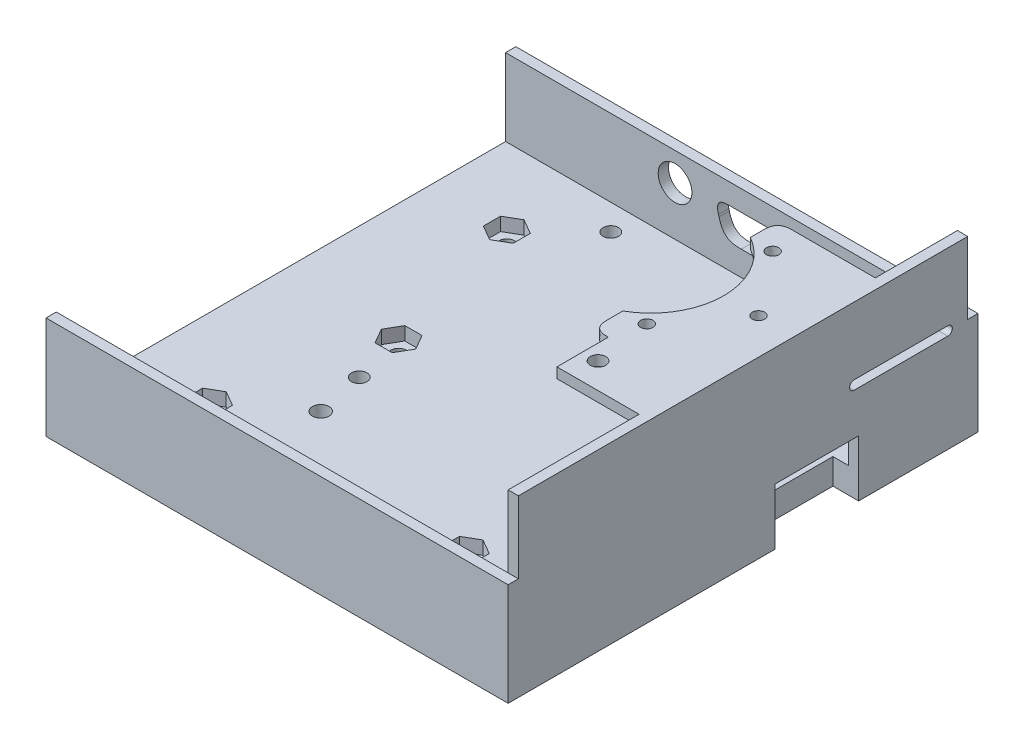
from build123d import *

# Parameters (mm, degrees)
SKETCH1_W                = 91
SKETCH1_H                = 91.5
SKETCH1_W_2              = 87
SKETCH1_H_2              = 87.5
SKETCH1_W_3              = 2
BOSS_EXTRUDE2_DEPTH      = 2
BOSS_EXTRUDE5_DEPTH      = 20
SKETCH3_W                = 2
SKETCH3_H                = 87.5
BOSS_EXTRUDE6_DEPTH      = 29
CUT_EXTRUDE1_DEPTH       = 107.787171514
CUT_EXTRUDE1_DEPTH_BACK  = 107.787171514
SKETCH4_W                = 1
SKETCH4_H                = 9.5
SKETCH4_H_2              = 6.5
SKETCH4_H_3              = 4
SKETCH8_W                = 36
SKETCH8_H                = 2
BOSS_EXTRUDE7_DEPTH      = 19
CUT_EXTRUDE3_REACH       = 73.584
SKETCH9_R                = 14.25
M2_CLEARANCE_HOLE1_D     = 2.4
M2_CLEARANCE_HOLE1_DEPTH = 2
SKETCH15_W               = 90
SKETCH15_H               = 3
CUT_EXTRUDE10_DEPTH      = 2
SKETCH5_W                = 90
SKETCH5_H                = 3
CUT_EXTRUDE11_DEPTH      = 2
CUT_EXTRUDE4_REACH       = 108.787
SKETCH13_R               = 3.28
FILLET2_SIZE             = 3
FILLET3_START            = -45.75
FILLET3_OUTLINE_W        = 45
FILLET3_OUTLINE_H        = 10
FILLET3_DEPTH            = 2
CUT_EXTRUDE7_REACH       = 107.613
SKETCH16_W               = 16.25
SKETCH16_H               = 8
CUT_EXTRUDE8_DEPTH       = 5
BOSS_EXTRUDE9_DEPTH      = 3
SKETCH17_R               = 1.5
CUT_EXTRUDE12_DEPTH      = 71.741165696
SKETCH19_R               = 1.625
CUT_EXTRUDE13_DEPTH      = 71.741165696
CUT_EXTRUDE21_DEPTH      = 2.6
SKETCH23_R               = 1.5
CUT_EXTRUDE22_DEPTH      = 8
CUT_EXTRUDE23_DEPTH      = 2.6
SKETCH24_W               = 20
SKETCH24_H               = 7
BOSS_EXTRUDE10_DEPTH     = 5
CUT_EXTRUDE26_REACH      = 72.741
SKETCH20_8_R             = 1.5
SKETCH26_W               = 10
SKETCH26_H               = 2
BOSS_EXTRUDE11_DEPTH     = 16
CUT_EXTRUDE27_REACH      = 77.394
SKETCH28_R               = 1.5
SKETCH29_R               = 1.55
SKETCH29_R_2             = 1.5
CUT_EXTRUDE28_DEPTH      = 2.6
CUT_EXTRUDE29_REACH      = 72.741
SKETCH29_3_R             = 1.5
SKETCH29_3_R_2           = 1.55


with BuildPart() as part:
    # Sketch1 → Boss-Extrude2 (new body)
    # profile 1 of 5: a face of its own
    with BuildSketch(Plane(origin=(0, 0, 0), x_dir=(1, 0, 0), z_dir=(0, 1, 0))):
        Rectangle(SKETCH1_W, SKETCH1_H)
        Rectangle(SKETCH1_W_2, SKETCH1_H_2, mode=Mode.SUBTRACT)
    # profile 2 of 5: a face of its own
    with BuildSketch(Plane(origin=(0, 0, 0), x_dir=(1, 0, 0), z_dir=(0, 1, 0))):
        Rectangle(SKETCH1_W_2, SKETCH1_H_2)
    # profile 3 of 5: a face of its own
    with BuildSketch(Plane(origin=(0, 0, 0), x_dir=(1, 0, 0), z_dir=(0, 1, 0))):
        with Locations((-44.5, 0)):
            Rectangle(SKETCH1_W_3, SKETCH1_H_2)
    # profile 4 of 5: a face of its own
    with BuildSketch(Plane(origin=(0, 0, 0), x_dir=(1, 0, 0), z_dir=(0, 1, 0))):
        with Locations((44.5, 0)):
            Rectangle(SKETCH1_W_3, SKETCH1_H_2)
    # profile 5 of 5: a face of its own
    with BuildSketch(Plane(origin=(0, 0, 0), x_dir=(1, 0, 0), z_dir=(0, 1, 0))):
        Polygon((-45.5, 45.75), (-45.5, 43.75), (-43.5, 43.75), (43.5, 43.75), (45.5, 43.75), (45.5, 45.75), align=None)
    extrude(amount=BOSS_EXTRUDE2_DEPTH)

    # Sketch1<4> → Boss-Extrude5 (add)
    with BuildSketch(Plane(origin=(0, 0, 0), x_dir=(1, 0, 0), z_dir=(0, 1, 0))):
        Polygon((-45.5, -43.75), (-45.5, -45.75), (45.5, -45.75), (45.5, -43.75), (43.5, -43.75), (-43.5, -43.75), align=None)
        Polygon((-45.5, 45.75), (-45.5, 43.75), (-43.5, 43.75), (43.5, 43.75), (45.5, 43.75), (45.5, 45.75), align=None)
    extrude(amount=BOSS_EXTRUDE5_DEPTH)

    # Sketch3 → Boss-Extrude6 (add)
    with BuildSketch(Plane(origin=(0, 2, 0), x_dir=(1, 0, 0), z_dir=(0, 1, 0))):
        with Locations((44.5, 0)):
            Rectangle(SKETCH3_W, SKETCH3_H)
    extrude(amount=BOSS_EXTRUDE6_DEPTH)

    # Sketch4 → Cut-Extrude1 (cut, two sides: drawn at the far end of the back side and taken through both)
    with BuildSketch(Plane.XY.offset(45.75).offset(-CUT_EXTRUDE1_DEPTH_BACK)):
        with Locations((-45, 15.25)):
            Rectangle(SKETCH4_W, SKETCH4_H)
        with Locations((-45, 3.25)):
            Rectangle(SKETCH4_W, SKETCH4_H_2)
        with Locations((-45, 8.5)):
            Rectangle(SKETCH4_W, SKETCH4_H_3)
    extrude(amount=CUT_EXTRUDE1_DEPTH + CUT_EXTRUDE1_DEPTH_BACK, mode=Mode.SUBTRACT)

    # Sketch8 → Boss-Extrude7 (add)
    with BuildSketch(Plane.ZY.offset(-43.5)):
        with Locations((-9.75, 30)):
            Rectangle(SKETCH8_W, SKETCH8_H)
    extrude(amount=BOSS_EXTRUDE7_DEPTH)

    # Sketch9 → Cut-Extrude3 (cut, up to next)
    with BuildSketch(Plane(origin=(0, 31, 0), x_dir=(1, 0, 0), z_dir=(0, 1, 0)), mode=Mode.PRIVATE) as cut_extrude3_sk1:
        with Locations((17.5, 10)):
            Circle(SKETCH9_R)
    cut_extrude3_tool1 = extrude(cut_extrude3_sk1.sketch, amount=-CUT_EXTRUDE3_REACH, mode=Mode.PRIVATE) & part.part
    add(cut_extrude3_tool1.solids().sort_by_distance((17.5, 31, -10))[0], mode=Mode.SUBTRACT)

    # M2 Clearance Hole1
    with Locations(Plane(origin=(0, 31, 0), x_dir=(1, 0, 0), z_dir=(0, 1, 0))):
        with Locations((29, -2.25), (38.5, 10), (29, 22.25)):
            Hole(M2_CLEARANCE_HOLE1_D / 2, depth=M2_CLEARANCE_HOLE1_DEPTH)

    # Sketch15 → Cut-Extrude10 (cut)
    with BuildSketch(Plane(origin=(0, 0, -45.75), x_dir=(-1, 0, 0), z_dir=(0, 0, -1))):
        with Locations((-0.5, 18.5)):
            Rectangle(SKETCH15_W, SKETCH15_H)
    extrude(amount=-CUT_EXTRUDE10_DEPTH, mode=Mode.SUBTRACT)

    # Sketch5 → Cut-Extrude11 (cut)
    with BuildSketch(Plane.XY.offset(45.75)):
        with Locations((0.5, 18.5)):
            Rectangle(SKETCH5_W, SKETCH5_H)
    extrude(amount=-CUT_EXTRUDE11_DEPTH, mode=Mode.SUBTRACT)

    # Sketch13 → Cut-Extrude4 (cut, up to next)
    with BuildSketch(Plane(origin=(0, 0, -45.75), x_dir=(-1, 0, 0), z_dir=(0, 0, -1)), mode=Mode.PRIVATE) as cut_extrude4_sk1:
        with Locations((11.5, 11.5)):
            Circle(SKETCH13_R)
    cut_extrude4_tool1 = extrude(cut_extrude4_sk1.sketch, amount=-CUT_EXTRUDE4_REACH, mode=Mode.PRIVATE) & part.part
    # Sketch13 → Cut-Extrude4 (cut, up to next)
    with BuildSketch(Plane(origin=(0, 0, -45.75), x_dir=(-1, 0, 0), z_dir=(0, 0, -1)), mode=Mode.PRIVATE) as cut_extrude4_sk2:
        Polygon((-8, 6.8), (2, 6.8), (3.75, 13), (-9.75, 13), align=None)
    cut_extrude4_tool2 = extrude(cut_extrude4_sk2.sketch, amount=-CUT_EXTRUDE4_REACH, mode=Mode.PRIVATE) & part.part
    # Sketch13 → Cut-Extrude4 (cut, up to next)
    with BuildSketch(Plane(origin=(0, 0, -45.75), x_dir=(-1, 0, 0), z_dir=(0, 0, -1)), mode=Mode.PRIVATE) as cut_extrude4_sk3:
        Polygon((-11.7, 6.75), (-9.95, 13), (-23.45, 13), (-21.7, 6.75), align=None)
    cut_extrude4_tool3 = extrude(cut_extrude4_sk3.sketch, amount=-CUT_EXTRUDE4_REACH, mode=Mode.PRIVATE) & part.part
    # Sketch13 → Cut-Extrude4 (cut, up to next)
    with BuildSketch(Plane(origin=(0, 0, -45.75), x_dir=(-1, 0, 0), z_dir=(0, 0, -1)), mode=Mode.PRIVATE) as cut_extrude4_sk4:
        Polygon((-38.26, 13), (-24.76, 13), (-26.51, 6.75), (-36.51, 6.75), align=None)
    cut_extrude4_tool4 = extrude(cut_extrude4_sk4.sketch, amount=-CUT_EXTRUDE4_REACH, mode=Mode.PRIVATE) & part.part
    add(cut_extrude4_tool1.solids().sort_by_distance((-11.5, 11.5, -45.75))[0], mode=Mode.SUBTRACT)
    add(cut_extrude4_tool2.solids().sort_by_distance((3, 10.053901, -45.75))[0], mode=Mode.SUBTRACT)
    add(cut_extrude4_tool3.solids().sort_by_distance((16.7, 10.030142, -45.75))[0], mode=Mode.SUBTRACT)
    add(cut_extrude4_tool4.solids().sort_by_distance((31.51, 10.030142, -45.75))[0], mode=Mode.SUBTRACT)

    # Fillet2
    # a fillet whose section is not a circle: 3 mm, written as the material it takes off along each edge
    with BuildSketch(Plane(origin=(24.5, 21.5, -27.75), x_dir=(1, 0, 0), z_dir=(0, 1, 0)), Plane(origin=(24.5, 38.5, 8.25), x_dir=(1, 0, 0), z_dir=(0, -1, 0))) as fillet2_piece_1:
        with BuildLine():
            add(Edge.make_bspline([(FILLET2_SIZE, 0), (FILLET2_SIZE * 0.831801948466, 0), (FILLET2_SIZE * 0.663603896932, 0), (FILLET2_SIZE * 0.292893218813, -FILLET2_SIZE * 0.0716919198361), (FILLET2_SIZE * 0.0716919198361, -FILLET2_SIZE * 0.292893218813), (0, -FILLET2_SIZE * 0.663603896932), (0, -FILLET2_SIZE * 0.831801948466), (0, -FILLET2_SIZE)], knots=[0, 0, 0, 0, 0, 0, 0.5, 0.5, 1, 1, 1, 1, 1, 1], degree=5))
            Line((0, -FILLET2_SIZE), (0, 0))
            Line((0, 0), (FILLET2_SIZE, 0))
        make_face()
    extrude(amount=17, mode=Mode.SUBTRACT)

    # Fillet3: read off the stored shape, not the designer's step
    # Fillet3 outline → Fillet3 (add)
    # profile 1 of 5: a face of its own
    with BuildSketch(Plane.XY.offset(FILLET3_START)):
        with Locations((17.5, 10)):
            Rectangle(FILLET3_OUTLINE_W, FILLET3_OUTLINE_H)
        with BuildLine():
            Line((4.594339469, 6.8), (1.405660531, 6.8))
            add(Edge.make_bspline(
                [(1.405660531, 6.8), (0.810289384, 6.8), (0.214918236, 6.8), (-1.10940405, 7.001225111), (-2.048266916, 7.711769157), (-2.601670361, 8.931632138), (-2.76339966, 9.504615939), (-2.925128959, 10.077599741)],
                knots=[0, 0, 0, 0, 0, 0, 0.5, 0.5, 1, 1, 1, 1, 1, 1], degree=5))
            Line((-2.925128959, 10.077599741), (-3.032136168, 10.456710996))
            add(Edge.make_bspline(
                [(-3.032136168, 10.456710996), (-3.146764266, 10.862821971), (-3.261392364, 11.268932946), (-3.301677592, 12.20694283), (-2.864979315, 12.783965182), (-1.951297532, 13), (-1.529319186, 13), (-1.107340839, 13)],
                knots=[0, 0, 0, 0, 0, 0, 0.5, 0.5, 1, 1, 1, 1, 1, 1], degree=5))
            Line((-1.107340839, 13), (7.107340839, 13))
            add(Edge.make_bspline(
                [(7.107340839, 13), (7.529319186, 13), (7.951297532, 13), (8.864979315, 12.783965182), (9.301677592, 12.20694283), (9.261392364, 11.268932946), (9.146764266, 10.862821971), (9.032136168, 10.456710996)],
                knots=[0, 0, 0, 0, 0, 0, 0.5, 0.5, 1, 1, 1, 1, 1, 1], degree=5))
            Line((9.032136168, 10.456710996), (8.925128959, 10.077599741))
            Line((8.925128959, 10.077599741), (8, 6.8))
            Line((8, 6.8), (4.594339469, 6.8))
        make_face(mode=Mode.SUBTRACT)
        with BuildLine():
            Line((18.286928205, 6.75), (15.113071795, 6.75))
            Line((15.113071795, 6.75), (11.7, 6.75))
            Line((11.7, 6.75), (10.779733706, 10.036665335))
            Line((10.779733706, 10.036665335), (10.660992758, 10.460740149))
            add(Edge.make_bspline(
                [(10.660992758, 10.460740149), (10.547409966, 10.86639298), (10.433827173, 11.272045811), (10.395277943, 12.208610834), (10.832139551, 12.784595564), (11.744411997, 13), (12.165666397, 13), (12.586920798, 13)],
                knots=[0, 0, 0, 0, 0, 0, 0.5, 0.5, 1, 1, 1, 1, 1, 1], degree=5))
            Line((12.586920798, 13), (20.813079202, 13))
            add(Edge.make_bspline(
                [(20.813079202, 13), (21.234333603, 13), (21.655588003, 13), (22.567860449, 12.784595564), (23.004722057, 12.208610834), (22.966172827, 11.272045811), (22.852590034, 10.86639298), (22.739007242, 10.460740149)],
                knots=[0, 0, 0, 0, 0, 0, 0.5, 0.5, 1, 1, 1, 1, 1, 1], degree=5))
            Line((22.739007242, 10.460740149), (22.620266294, 10.036665335))
            Line((22.620266294, 10.036665335), (21.7, 6.75))
            Line((21.7, 6.75), (18.286928205, 6.75))
        make_face(mode=Mode.SUBTRACT)
        with BuildLine():
            Line((33.096928205, 6.75), (29.923071795, 6.75))
            add(Edge.make_bspline(
                [(29.923071795, 6.75), (29.326555279, 6.75), (28.730038762, 6.75), (27.403227046, 6.952006757), (26.463684497, 7.664612574), (25.911411114, 8.88781745), (25.75057241, 9.462241393), (25.589733706, 10.036665335)],
                knots=[0, 0, 0, 0, 0, 0, 0.5, 0.5, 1, 1, 1, 1, 1, 1], degree=5))
            Line((25.589733706, 10.036665335), (25.470992758, 10.460740149))
            add(Edge.make_bspline(
                [(25.470992758, 10.460740149), (25.357409966, 10.86639298), (25.243827173, 11.272045811), (25.205277943, 12.208610834), (25.642139551, 12.784595564), (26.554411997, 13), (26.975666397, 13), (27.396920798, 13)],
                knots=[0, 0, 0, 0, 0, 0, 0.5, 0.5, 1, 1, 1, 1, 1, 1], degree=5))
            Line((27.396920798, 13), (35.623079202, 13))
            add(Edge.make_bspline(
                [(35.623079202, 13), (36.044333603, 13), (36.465588003, 13), (37.377860449, 12.784595564), (37.814722057, 12.208610834), (37.776172827, 11.272045811), (37.662590034, 10.86639298), (37.549007242, 10.460740149)],
                knots=[0, 0, 0, 0, 0, 0, 0.5, 0.5, 1, 1, 1, 1, 1, 1], degree=5))
            Line((37.549007242, 10.460740149), (37.430266294, 10.036665335))
            Line((37.430266294, 10.036665335), (36.51, 6.75))
            Line((36.51, 6.75), (33.096928205, 6.75))
        make_face(mode=Mode.SUBTRACT)
    # profile 2 of 5: a face of its own
    with BuildSketch(Plane.XY.offset(FILLET3_START)):
        with BuildLine():
            Line((8, 6.8), (8.925128959, 10.077599741))
            add(Edge.make_bspline(
                [(8.925128959, 10.077599741), (8.76339966, 9.504615939), (8.601670361, 8.931632138), (8.048266916, 7.711769157), (7.10940405, 7.001225111), (5.785081764, 6.8), (5.189710616, 6.8), (4.594339469, 6.8)],
                knots=[0, 0, 0, 0, 0, 0, 0.5, 0.5, 1, 1, 1, 1, 1, 1], degree=5))
            Line((4.594339469, 6.8), (8, 6.8))
        make_face()
    # profile 3 of 5: a face of its own
    with BuildSketch(Plane.XY.offset(FILLET3_START)):
        with BuildLine():
            add(Edge.make_bspline(
                [(22.620266294, 10.036665335), (22.45942759, 9.462241393), (22.298588886, 8.88781745), (21.746315503, 7.664612574), (20.806772954, 6.952006757), (19.479961238, 6.75), (18.883444721, 6.75), (18.286928205, 6.75)],
                knots=[0, 0, 0, 0, 0, 0, 0.5, 0.5, 1, 1, 1, 1, 1, 1], degree=5))
            Line((18.286928205, 6.75), (21.7, 6.75))
            Line((21.7, 6.75), (22.620266294, 10.036665335))
        make_face()
    # profile 4 of 5: a face of its own
    with BuildSketch(Plane.XY.offset(FILLET3_START)):
        with BuildLine():
            Line((11.7, 6.75), (15.113071795, 6.75))
            add(Edge.make_bspline(
                [(15.113071795, 6.75), (14.516555279, 6.75), (13.920038762, 6.75), (12.593227046, 6.952006757), (11.653684497, 7.664612574), (11.101411114, 8.88781745), (10.94057241, 9.462241393), (10.779733706, 10.036665335)],
                knots=[0, 0, 0, 0, 0, 0, 0.5, 0.5, 1, 1, 1, 1, 1, 1], degree=5))
            Line((10.779733706, 10.036665335), (11.7, 6.75))
        make_face()
    # profile 5 of 5: a face of its own
    with BuildSketch(Plane.XY.offset(FILLET3_START)):
        with BuildLine():
            add(Edge.make_bspline(
                [(37.430266294, 10.036665335), (37.26942759, 9.462241393), (37.108588886, 8.88781745), (36.556315503, 7.664612574), (35.616772954, 6.952006757), (34.289961238, 6.75), (33.693444721, 6.75), (33.096928205, 6.75)],
                knots=[0, 0, 0, 0, 0, 0, 0.5, 0.5, 1, 1, 1, 1, 1, 1], degree=5))
            Line((33.096928205, 6.75), (36.51, 6.75))
            Line((36.51, 6.75), (37.430266294, 10.036665335))
        make_face()
    extrude(amount=FILLET3_DEPTH)

    # Sketch14 → Cut-Extrude7 (cut, up to next)
    with BuildSketch(Plane(origin=(45.5, 0, 0), x_dir=(0, 0, -1), z_dir=(1, 0, 0)), mode=Mode.PRIVATE) as cut_extrude7_sk1:
        with BuildLine():
            Line((21.625, 17.875), (39.875, 17.875))
            ThreePointArc((39.875, 17.875), (40.75, 17), (39.875, 16.125))
            Line((39.875, 16.125), (21.625, 16.125))
            ThreePointArc((21.625, 16.125), (20.75, 17), (21.625, 17.875))
        make_face()
    cut_extrude7_tool1 = extrude(cut_extrude7_sk1.sketch, amount=-CUT_EXTRUDE7_REACH, mode=Mode.PRIVATE) & part.part
    add(cut_extrude7_tool1.solids().sort_by_distance((45.5, 17, -30.75))[0], mode=Mode.SUBTRACT)

    # Sketch16 → Cut-Extrude8 (cut)
    with BuildSketch(Plane(origin=(45.5, 0, 0), x_dir=(0, 0, -1), z_dir=(1, 0, 0))):
        with Locations((14.375, 4)):
            Rectangle(SKETCH16_W, SKETCH16_H)
    extrude(amount=-CUT_EXTRUDE8_DEPTH, mode=Mode.SUBTRACT)

    # Sketch18 → Boss-Extrude9 (add)
    with BuildSketch(Plane.XZ):
        Polygon((45.5, -45.75), (-44.5, -45.75), (-44.5, 45.75), (45.5, 45.75), (45.5, -6.25), (40.5, -6.25), (40.5, -22.5), (45.5, -22.5), align=None)
    extrude(amount=BOSS_EXTRUDE9_DEPTH)

    # Sketch17 → Cut-Extrude12 (cut, through all)
    with BuildSketch(Plane(origin=(0, 2, 0), x_dir=(1, 0, 0), z_dir=(0, 1, 0))):
        with Locations(Location((39, -10.25, 0), (0, 0, 270))):
            Circle(SKETCH17_R)
        with Locations(Location((39, 38.75, 0), (0, 0, 270))):
            Circle(SKETCH17_R)
        with Locations(Location((-19, -10.25, 0), (0, 0, 270))):
            Circle(SKETCH17_R)
        with Locations(Location((-19, 38.75, 0), (0, 0, 270))):
            Circle(SKETCH17_R)
    extrude(amount=-CUT_EXTRUDE12_DEPTH, mode=Mode.SUBTRACT)

    # Sketch19 → Cut-Extrude13 (cut, through all)
    with BuildSketch(Plane(origin=(0, 2, 0), x_dir=(1, 0, 0), z_dir=(0, 1, 0))):
        with Locations(Location((39, -19.75, 0), (0, 0, 270))):
            Circle(SKETCH19_R)
        with Locations(Location((39, -38.75, 0), (0, 0, 270))):
            Circle(SKETCH19_R)
        with Locations(Location((-17, -38.75, 0), (0, 0, 270))):
            Circle(SKETCH19_R)
        with Locations(Location((-17, -19.75, 0), (0, 0, 270))):
            Circle(SKETCH19_R)
    extrude(amount=-CUT_EXTRUDE13_DEPTH, mode=Mode.SUBTRACT)

    # Sketch22 → Cut-Extrude21 (cut)
    with BuildSketch(Plane.XZ.offset(3)):
        Polygon((-15.824573519, -38.75), (-17.41228676, -36), (-20.58771324, -36), (-22.175426481, -38.75), (-20.58771324, -41.5), (-17.41228676, -41.5), align=None)
        Polygon((42.175426481, -38.75), (40.58771324, -36), (37.41228676, -36), (35.824573519, -38.75), (37.41228676, -41.5), (40.58771324, -41.5), align=None)
        Polygon((42.175426481, 10.25), (40.58771324, 13), (37.41228676, 13), (35.824573519, 10.25), (37.41228676, 7.5), (40.58771324, 7.5), align=None)
        Polygon((-15.824573519, 10.25), (-17.41228676, 13), (-20.58771324, 13), (-22.175426481, 10.25), (-20.58771324, 7.5), (-17.41228676, 7.5), align=None)
    extrude(amount=-CUT_EXTRUDE21_DEPTH, mode=Mode.SUBTRACT)

    # Sketch23 → Cut-Extrude22 (cut)
    with BuildSketch(Plane.ZY.offset(44.5)):
        with Locations((0, -0.5)):
            Circle(SKETCH23_R)
    extrude(amount=-CUT_EXTRUDE22_DEPTH, mode=Mode.SUBTRACT)

    # Sketch20 → Cut-Extrude23 (cut)
    with BuildSketch(Plane(origin=(0, 2, 0), x_dir=(-1, 0, 0), z_dir=(0, -1, 0))):
        Polygon((29.504171253, -25.651368439), (26.604171253, -27.325684219), (26.604171253, -30.674315781), (29.504171253, -32.348631561), (32.404171253, -30.674315781), (32.404171253, -27.325684219), align=None)
        Polygon((29.504171253, 32.348631561), (26.604171253, 30.674315781), (26.604171253, 27.325684219), (29.504171253, 25.651368439), (32.404171253, 27.325684219), (32.404171253, 30.674315781), align=None)
        Polygon((-20.495828747, 32.348631561), (-23.395828747, 30.674315781), (-23.395828747, 27.325684219), (-20.495828747, 25.651368439), (-17.595828747, 27.325684219), (-17.595828747, 30.674315781), align=None)
        Polygon((-20.495828747, -25.651368439), (-23.395828747, -27.325684219), (-23.395828747, -30.674315781), (-20.495828747, -32.348631561), (-17.595828747, -30.674315781), (-17.595828747, -27.325684219), align=None)
    extrude(amount=CUT_EXTRUDE23_DEPTH, mode=Mode.SUBTRACT)

    # Sketch24 → Boss-Extrude10 (add)
    with BuildSketch(Plane(origin=(0, -3, 0), x_dir=(-1, 0, 0), z_dir=(0, -1, 0))):
        with Locations((-23, 0)):
            Rectangle(SKETCH24_W, SKETCH24_H)
        with Locations((22, 0)):
            Rectangle(SKETCH24_W, SKETCH24_H)
    extrude(amount=BOSS_EXTRUDE10_DEPTH)

    # Sketch20<8> → Cut-Extrude26 (cut, up to next)
    with BuildSketch(Plane(origin=(0, 2, 0), x_dir=(-1, 0, 0), z_dir=(0, -1, 0)), mode=Mode.PRIVATE) as cut_extrude26_sk1:
        with Locations(Location((29.504171253, -29, 0), (0, 0, 270))):
            Circle(SKETCH20_8_R)
    cut_extrude26_tool1 = extrude(cut_extrude26_sk1.sketch, amount=CUT_EXTRUDE26_REACH, mode=Mode.PRIVATE) & part.part
    # Sketch20<8> → Cut-Extrude26 (cut, up to next)
    with BuildSketch(Plane(origin=(0, 2, 0), x_dir=(-1, 0, 0), z_dir=(0, -1, 0)), mode=Mode.PRIVATE) as cut_extrude26_sk2:
        with Locations(Location((-20.495828747, 29, 0), (0, 0, 270))):
            Circle(SKETCH20_8_R)
    cut_extrude26_tool2 = extrude(cut_extrude26_sk2.sketch, amount=CUT_EXTRUDE26_REACH, mode=Mode.PRIVATE) & part.part
    # Sketch20<8> → Cut-Extrude26 (cut, up to next)
    with BuildSketch(Plane(origin=(0, 2, 0), x_dir=(-1, 0, 0), z_dir=(0, -1, 0)), mode=Mode.PRIVATE) as cut_extrude26_sk3:
        with Locations(Location((29.504171253, 29, 0), (0, 0, 270))):
            Circle(SKETCH20_8_R)
    cut_extrude26_tool3 = extrude(cut_extrude26_sk3.sketch, amount=CUT_EXTRUDE26_REACH, mode=Mode.PRIVATE) & part.part
    # Sketch20<8> → Cut-Extrude26 (cut, up to next)
    with BuildSketch(Plane(origin=(0, 2, 0), x_dir=(-1, 0, 0), z_dir=(0, -1, 0)), mode=Mode.PRIVATE) as cut_extrude26_sk4:
        with Locations(Location((-20.495828747, -29, 0), (0, 0, 270))):
            Circle(SKETCH20_8_R)
    cut_extrude26_tool4 = extrude(cut_extrude26_sk4.sketch, amount=CUT_EXTRUDE26_REACH, mode=Mode.PRIVATE) & part.part
    add(cut_extrude26_tool1.solids().sort_by_distance((-29.504171, 2, 29))[0], mode=Mode.SUBTRACT)
    add(cut_extrude26_tool2.solids().sort_by_distance((20.495829, 2, -29))[0], mode=Mode.SUBTRACT)
    add(cut_extrude26_tool3.solids().sort_by_distance((-29.504171, 2, -29))[0], mode=Mode.SUBTRACT)
    add(cut_extrude26_tool4.solids().sort_by_distance((20.495829, 2, 29))[0], mode=Mode.SUBTRACT)

    # Sketch26 → Boss-Extrude11 (add)
    with BuildSketch(Plane.ZY.offset(-43.5)):
        with Locations((13.25, 30)):
            Rectangle(SKETCH26_W, SKETCH26_H)
    extrude(amount=BOSS_EXTRUDE11_DEPTH)

    # Sketch28 → Cut-Extrude27 (cut, up to next)
    with BuildSketch(Plane(origin=(0, 31, 0), x_dir=(1, 0, 0), z_dir=(0, 1, 0)), mode=Mode.PRIVATE) as cut_extrude27_sk1:
        with Locations(Location((30.5, -13.25, 0), (0, 0, 270))):
            Circle(SKETCH28_R)
    cut_extrude27_tool1 = extrude(cut_extrude27_sk1.sketch, amount=-CUT_EXTRUDE27_REACH, mode=Mode.PRIVATE) & part.part
    add(cut_extrude27_tool1.solids().sort_by_distance((30.5, 31, 13.25))[0], mode=Mode.SUBTRACT)

    # Sketch29 → Cut-Extrude28 (cut)
    # profile 1 of 4: a face of its own
    with BuildSketch(Plane(origin=(0, 2, 0), x_dir=(-1, 0, 0), z_dir=(0, -1, 0))):
        Polygon((-21.458587828, -2.9), (-19.784272047, 0), (-21.458587828, 2.9), (-24.807219389, 2.9), (-26.48153517, 0), (-24.807219389, -2.9), align=None)
        with Locations((-23.132903608, 0)):
            Circle(SKETCH29_R, mode=Mode.SUBTRACT)
    # profile 2 of 4: a face of its own
    with BuildSketch(Plane(origin=(0, 2, 0), x_dir=(-1, 0, 0), z_dir=(0, -1, 0))):
        with Locations((-23.132903608, 0)):
            Circle(SKETCH29_R)
    # profile 3 of 4: a face of its own
    with BuildSketch(Plane(origin=(0, 2, 0), x_dir=(-1, 0, 0), z_dir=(0, -1, 0))):
        Polygon((23.267847458, -2.9), (24.942163238, 0), (23.267847458, 2.9), (19.919215896, 2.9), (18.244900116, 0), (19.919215896, -2.9), align=None)
        with Locations((21.593531677, 0)):
            Circle(SKETCH29_R_2, mode=Mode.SUBTRACT)
    # profile 4 of 4: a face of its own
    with BuildSketch(Plane(origin=(0, 2, 0), x_dir=(-1, 0, 0), z_dir=(0, -1, 0))):
        with Locations((21.593531677, 0)):
            Circle(SKETCH29_R_2)
    extrude(amount=CUT_EXTRUDE28_DEPTH, mode=Mode.SUBTRACT)

    # Sketch29<3> → Cut-Extrude29 (cut, up to next)
    with BuildSketch(Plane(origin=(0, 2, 0), x_dir=(-1, 0, 0), z_dir=(0, -1, 0)), mode=Mode.PRIVATE) as cut_extrude29_sk1:
        with Locations(Location((21.593531677, 0, 0), (0, 0, 270))):
            Circle(SKETCH29_3_R)
    cut_extrude29_tool1 = extrude(cut_extrude29_sk1.sketch, amount=CUT_EXTRUDE29_REACH, mode=Mode.PRIVATE) & part.part
    # Sketch29<3> → Cut-Extrude29 (cut, up to next)
    with BuildSketch(Plane(origin=(0, 2, 0), x_dir=(-1, 0, 0), z_dir=(0, -1, 0)), mode=Mode.PRIVATE) as cut_extrude29_sk2:
        with Locations(Location((-23.132903608, 0, 0), (0, 0, 270))):
            Circle(SKETCH29_3_R_2)
    cut_extrude29_tool2 = extrude(cut_extrude29_sk2.sketch, amount=CUT_EXTRUDE29_REACH, mode=Mode.PRIVATE) & part.part
    add(cut_extrude29_tool1.solids().sort_by_distance((-21.593532, 2, 0))[0], mode=Mode.SUBTRACT)
    add(cut_extrude29_tool2.solids().sort_by_distance((23.132904, 2, 0))[0], mode=Mode.SUBTRACT)


solid = part.part
